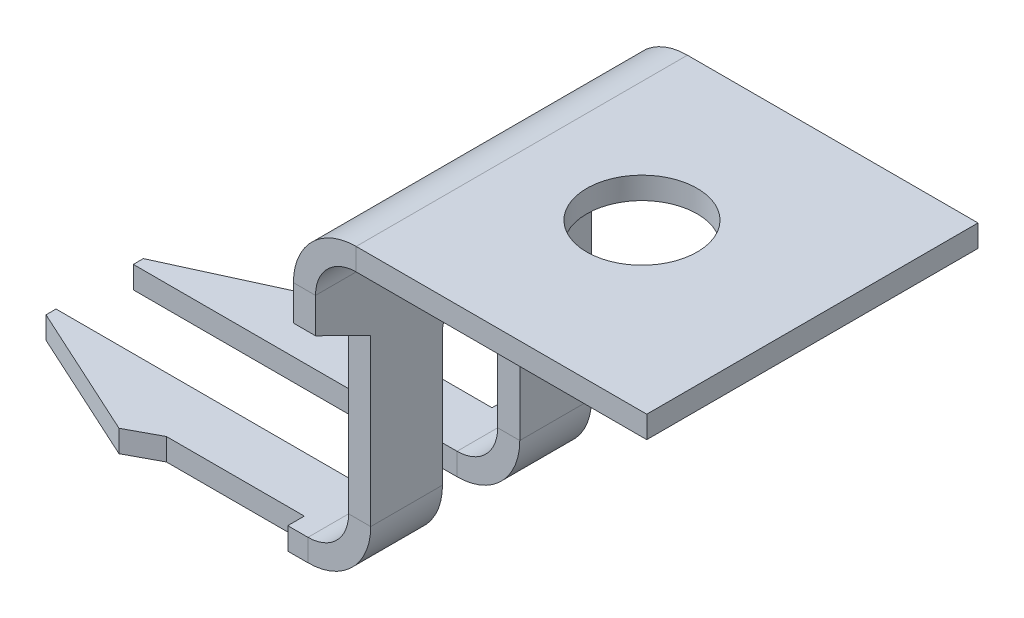
from build123d import *

# Parameters (mm, degrees)
SM_BASE_FLANGE_1_DEPTH = 6
SKETCH_5_R             = 1
CUT_EXTRUDE_1_DEPTH    = 12.223190277
CUT_EXTRUDE_3_REACH    = 17.683
CUT_EXTRUDE_4_REACH    = 13.223


# Sheet-metal steps are written as plain solids
with BuildPart() as part:
    # Sketch 1 → 基体-法兰1 (new body)
    with BuildSketch(Plane.XY):
        with BuildLine():
            Line((-7, 0), (-1.1366, 0))
            ThreePointArc((-1.1366, 0), (-0.332902433, 0.332902433), (0, 1.1366))
            Line((0, 1.1366), (0, 5.2634))
            ThreePointArc((0, 5.2634), (0.215745145, 5.784254855), (0.7366, 6))
            Line((0.7366, 6), (6, 6))
            Line((6, 6), (6, 6.4))
            Line((6, 6.4), (0.7366, 6.4))
            ThreePointArc((0.7366, 6.4), (-0.067097567, 6.067097567), (-0.4, 5.2634))
            Line((-0.4, 5.2634), (-0.4, 1.1366))
            ThreePointArc((-0.4, 1.1366), (-0.615745145, 0.615745145), (-1.1366, 0.4))
            Line((-1.1366, 0.4), (-7, 0.4))
            Line((-7, 0.4), (-7, 0))
        make_face()
    extrude(amount=SM_BASE_FLANGE_1_DEPTH)

    # 草图5 → 切除-拉伸1 (cut, through all)
    with BuildSketch(Plane(origin=(0, 6.4, 0), x_dir=(1, 0, 0), z_dir=(0, 1, 0))):
        with Locations(Location((2.913465792, -3, 0), (0, 0, 270))):
            Circle(SKETCH_5_R)
    extrude(amount=-CUT_EXTRUDE_1_DEPTH, mode=Mode.SUBTRACT)

    # 草图6 → 切除-拉伸3 (cut, up to next)
    with BuildSketch(Plane.ZY.offset(7), mode=Mode.PRIVATE) as cut_extrude_3_sk1:
        with BuildLine():
            Line((2.3, -3.316111615), (2.3, 3.5366))
            ThreePointArc((2.3, 3.5366), (2.475735931, 3.960864069), (2.9, 4.1366))
            Line((2.9, 4.1366), (3, 4.1366))
            Line((3, 4.1366), (3.1, 4.1366))
            ThreePointArc((3.1, 4.1366), (3.524264069, 3.960864069), (3.7, 3.5366))
            Line((3.7, 3.5366), (3.7, -3.316111615))
            Line((3.7, -3.316111615), (2.3, -3.316111615))
        make_face()
    cut_extrude_3_tool1 = extrude(cut_extrude_3_sk1.sketch, amount=-CUT_EXTRUDE_3_REACH, mode=Mode.PRIVATE) & part.part
    # 草图6 → 切除-拉伸3 (cut, up to next)
    with BuildSketch(Plane.ZY.offset(7), mode=Mode.PRIVATE) as cut_extrude_3_sk2:
        Polygon((1, -3.316111615), (1, 4.1366), (0, 4.629449722), (0, -3.316111615), align=None)
    cut_extrude_3_tool2 = extrude(cut_extrude_3_sk2.sketch, amount=-CUT_EXTRUDE_3_REACH, mode=Mode.PRIVATE) & part.part
    # 草图6 → 切除-拉伸3 (cut, up to next)
    with BuildSketch(Plane.ZY.offset(7), mode=Mode.PRIVATE) as cut_extrude_3_sk3:
        Polygon((5, 4.1366), (6, 4.629449722), (6, -3.316111615), (5, -3.316111615), align=None)
    cut_extrude_3_tool3 = extrude(cut_extrude_3_sk3.sketch, amount=-CUT_EXTRUDE_3_REACH, mode=Mode.PRIVATE) & part.part
    add(cut_extrude_3_tool1.solids().sort_by_distance((-7, 0.356246, 3))[0], mode=Mode.SUBTRACT)
    add(cut_extrude_3_tool2.solids().sort_by_distance((-7, 0.534771, 0.494666))[0], mode=Mode.SUBTRACT)
    add(cut_extrude_3_tool3.solids().sort_by_distance((-7, 0.534771, 5.505334))[0], mode=Mode.SUBTRACT)

    # 草图7 → 切除-拉伸4 (cut, up to next)
    with BuildSketch(Plane.XZ, mode=Mode.PRIVATE) as cut_extrude_4_sk1:
        Polygon((-7, 3.881631359), (-4.559628285, 5), (-7, 5), align=None)
    cut_extrude_4_tool1 = extrude(cut_extrude_4_sk1.sketch, amount=-CUT_EXTRUDE_4_REACH, mode=Mode.PRIVATE) & part.part
    # 草图7 → 切除-拉伸4 (cut, up to next)
    with BuildSketch(Plane.XZ, mode=Mode.PRIVATE) as cut_extrude_4_sk2:
        Polygon((-1.502616723, 5), (-4, 5), (-4.559628285, 5), (-4, 4.7), (-1.502616723, 4.7), align=None)
    cut_extrude_4_tool2 = extrude(cut_extrude_4_sk2.sketch, amount=-CUT_EXTRUDE_4_REACH, mode=Mode.PRIVATE) & part.part
    # 草图7 → 切除-拉伸4 (cut, up to next)
    with BuildSketch(Plane.XZ, mode=Mode.PRIVATE) as cut_extrude_4_sk3:
        Polygon((-7, 2.118368641), (-7, 1), (-4.559628285, 1), align=None)
    cut_extrude_4_tool3 = extrude(cut_extrude_4_sk3.sketch, amount=-CUT_EXTRUDE_4_REACH, mode=Mode.PRIVATE) & part.part
    # 草图7 → 切除-拉伸4 (cut, up to next)
    with BuildSketch(Plane.XZ, mode=Mode.PRIVATE) as cut_extrude_4_sk4:
        Polygon((-4, 1.3), (-4.559628285, 1), (-4, 1), (-1.502616723, 1), (-1.502616723, 1.3), align=None)
    cut_extrude_4_tool4 = extrude(cut_extrude_4_sk4.sketch, amount=-CUT_EXTRUDE_4_REACH, mode=Mode.PRIVATE) & part.part
    add(cut_extrude_4_tool1.solids().sort_by_distance((-6.186543, 0, 4.62721))[0], mode=Mode.SUBTRACT)
    add(cut_extrude_4_tool2.solids().sort_by_distance((-2.895914, 0, 4.855038))[0], mode=Mode.SUBTRACT)
    add(cut_extrude_4_tool3.solids().sort_by_distance((-6.186543, 0, 1.37279))[0], mode=Mode.SUBTRACT)
    add(cut_extrude_4_tool4.solids().sort_by_distance((-2.895914, 0, 1.144962))[0], mode=Mode.SUBTRACT)


solid = part.part
